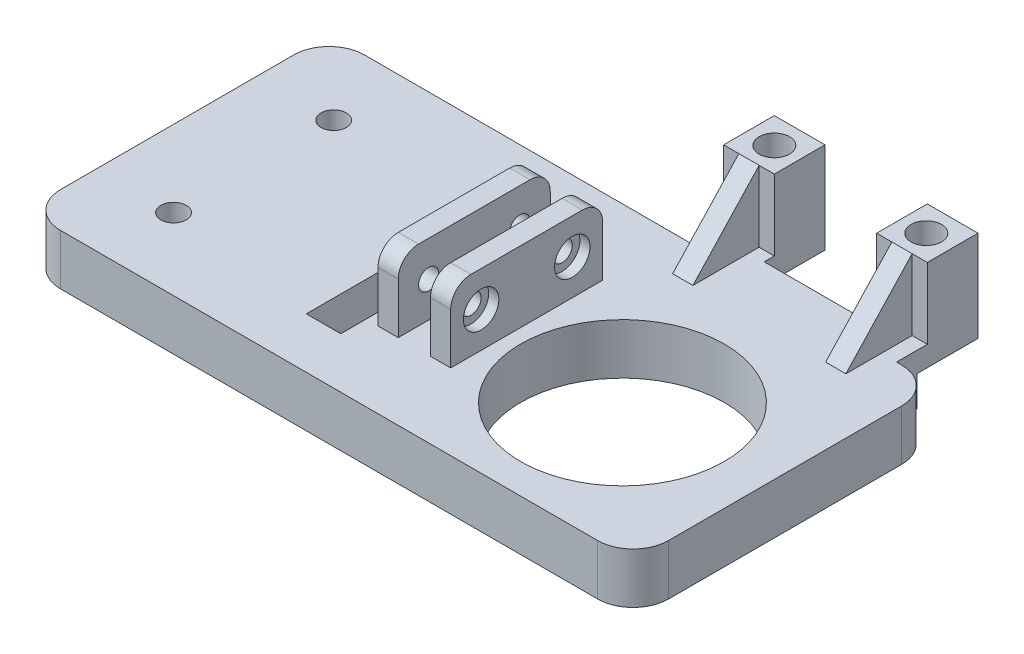
from build123d import *

# Parameters (mm, degrees)
SKETCH1_W           = 60
SKETCH1_H           = 30
BOSS_EXTRUDE1_DEPTH = 5
SKETCH2_R           = 1.25
SKETCH2_W           = 3.4
SKETCH2_H           = 20
CUT_EXTRUDE1_DEPTH  = 34.911649916
SKETCH3_R           = 10.05
CUT_EXTRUDE2_DEPTH  = 34.911649916
SKETCH4_W           = 20.1
SKETCH4_H           = 5
BOSS_EXTRUDE2_DEPTH = 8.04
SKETCH5_W           = 5
SKETCH5_H           = 5
SKETCH5_R           = 1.5
BOSS_EXTRUDE3_DEPTH = 7
SKETCH6_R           = 1.5
SKETCH6_W           = 10.1
SKETCH6_H           = 6
CUT_EXTRUDE3_DEPTH  = 5
RIB7_REACH          = 61.473
SKETCH8_WALL_W      = 130.526655278
SKETCH8_WALL_H      = 2
SKETCH9_W           = 5
SKETCH9_H           = 6
CUT_EXTRUDE4_DEPTH  = 3
SKETCH10_W          = 2
SKETCH10_H          = 15
BOSS_EXTRUDE4_DEPTH = 7
SKETCH11_R          = 1.75
CUT_EXTRUDE5_DEPTH  = 1
SKETCH12_R          = 1
CUT_EXTRUDE6_DEPTH  = 11
FILLET1_R           = 3.5
FILLET2_R           = 2


with BuildPart() as part:
    # Sketch1 → Boss-Extrude1 (new body)
    with BuildSketch(Plane(origin=(0, 0, 0), x_dir=(1, 0, 0), z_dir=(0, 1, 0))):
        Rectangle(SKETCH1_W, SKETCH1_H)
    extrude(amount=BOSS_EXTRUDE1_DEPTH)

    # Sketch2 → Cut-Extrude1 (cut, through all)
    with BuildSketch(Plane(origin=(0, 5, 0), x_dir=(1, 0, 0), z_dir=(0, 1, 0))):
        with Locations((-22.45, -7.9)):
            Circle(SKETCH2_R)
        with Locations((-22.45, 7.9)):
            Circle(SKETCH2_R)
        with Locations((-5.55, 0)):
            Rectangle(SKETCH2_W, SKETCH2_H)
    extrude(amount=-CUT_EXTRUDE1_DEPTH, mode=Mode.SUBTRACT)

    # Sketch3 → Cut-Extrude2 (cut, through all)
    with BuildSketch(Plane.XZ):
        with Locations((15.95, 2)):
            Circle(SKETCH3_R)
    extrude(amount=-CUT_EXTRUDE2_DEPTH, mode=Mode.SUBTRACT)

    # Sketch4 → Boss-Extrude2 (add)
    with BuildSketch(Plane(origin=(0, 0, -15), x_dir=(-1, 0, 0), z_dir=(0, 0, -1))):
        with Locations((-15.95, 2.5)):
            Rectangle(SKETCH4_W, SKETCH4_H)
    extrude(amount=BOSS_EXTRUDE2_DEPTH)

    # Sketch5 → Boss-Extrude3 (add)
    with BuildSketch(Plane(origin=(0, 5, 0), x_dir=(1, 0, 0), z_dir=(0, 1, 0))):
        with Locations((23.5, 20.54)):
            Rectangle(SKETCH5_W, SKETCH5_H)
        with Locations((23.45, 20.49)):
            Circle(SKETCH5_R, mode=Mode.SUBTRACT)
    boss_extrude3 = extrude(amount=BOSS_EXTRUDE3_DEPTH)

    # Sketch6 → Cut-Extrude3 (cut)
    with BuildSketch(Plane.XZ):
        with Locations((23.45, -20.49)):
            Circle(SKETCH6_R)
        with Locations((8.45, -20.49)):
            Circle(SKETCH6_R)
        with Locations((15.95, -20.04)):
            Rectangle(SKETCH6_W, SKETCH6_H)
    extrude(amount=-CUT_EXTRUDE3_DEPTH, mode=Mode.SUBTRACT)

    # Sketch8 wall → Rib7 (add, up to next)
    with BuildSketch(Plane(origin=(23.5, 8.5, -14.77), x_dir=(0, -0.730708043922, 0.68269008675), z_dir=(0, -0.68269008675, -0.730708043922)), mode=Mode.PRIVATE) as rib7_sk1:
        Rectangle(SKETCH8_WALL_W, SKETCH8_WALL_H)
    rib7_tool1 = extrude(rib7_sk1.sketch, amount=RIB7_REACH, mode=Mode.PRIVATE) - part.part
    rib7 = rib7_tool1.solids().sort_by_distance((23.5, 8.5, -14.77))[0]
    add(rib7)

    # Sketch9 → Cut-Extrude4 (cut)
    with BuildSketch(Plane.XZ):
        with Locations((23.5, -20.04)):
            Rectangle(SKETCH9_W, SKETCH9_H)
    cut_extrude4 = extrude(amount=-CUT_EXTRUDE4_DEPTH, mode=Mode.SUBTRACT)

    # Mirror1: Boss-Extrude3, Rib7, Cut-Extrude4 across plane
    add(boss_extrude3.mirror(Plane.ZY.offset(-15.95)))
    add(rib7.mirror(Plane.ZY.offset(-15.95)))
    add(cut_extrude4.mirror(Plane.ZY.offset(-15.95)), mode=Mode.SUBTRACT)

    # Sketch10 → Boss-Extrude4 (add)
    with BuildSketch(Plane(origin=(0, 5, 0), x_dir=(1, 0, 0), z_dir=(0, 1, 0))):
        with Locations((3.5, 0)):
            Rectangle(SKETCH10_W, SKETCH10_H)
        with Locations((-1.675, 0)):
            Rectangle(SKETCH10_W, SKETCH10_H)
    extrude(amount=BOSS_EXTRUDE4_DEPTH)

    # Sketch11 → Cut-Extrude5 (cut)
    with BuildSketch(Plane(origin=(4.5, 0, 0), x_dir=(0, 0, -1), z_dir=(1, 0, 0))):
        with Locations((4.5, 8.5)):
            Circle(SKETCH11_R)
        with Locations((-4.5, 8.5)):
            Circle(SKETCH11_R)
    extrude(amount=-CUT_EXTRUDE5_DEPTH, mode=Mode.SUBTRACT)

    # Sketch12 → Cut-Extrude6 (cut)
    with BuildSketch(Plane(origin=(3.5, 0, 0), x_dir=(0, 0, -1), z_dir=(1, 0, 0))):
        with Locations((-4.5, 8.5)):
            Circle(SKETCH12_R)
        with Locations((4.5, 8.5)):
            Circle(SKETCH12_R)
    extrude(amount=-CUT_EXTRUDE6_DEPTH, mode=Mode.SUBTRACT)

    # Fillet1
    fillet1_edges = [part.edges().sort_by_distance(p)[0] for p in [
        (-30, 2.5, 15),
        (-30, 2.5, -15),
        (30, 2.5, 15),
        (30, 2.5, -15),
    ]]
    fillet(fillet1_edges, radius=FILLET1_R)

    # Fillet2
    fillet2_edges = [part.edges().sort_by_distance(p)[0] for p in [
        (-1.675, 12, 7.5),
        (3.5, 12, 7.5),
        (-1.675, 12, -7.5),
        (3.5, 12, -7.5),
    ]]
    fillet(fillet2_edges, radius=FILLET2_R)


solid = part.part
